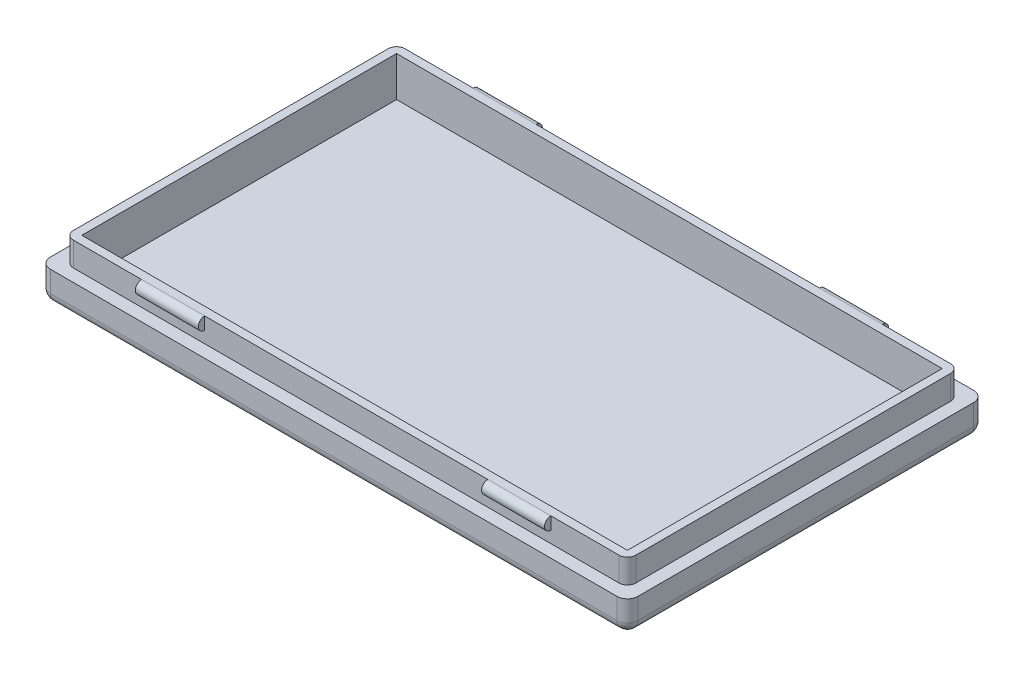
from build123d import *

# Parameters (mm, degrees)
SKETCH1_W           = 56
SKETCH1_H           = 34
BOSS_EXTRUDE1_DEPTH = 1.5
SKETCH1_3_W         = 56
SKETCH1_3_H         = 34
SKETCH1_3_W_2       = 52
SKETCH1_3_H_2       = 30
BOSS_EXTRUDE2_DEPTH = 3
SKETCH2_W           = 53.6
SKETCH2_H           = 31.6
SKETCH2_W_2         = 52
SKETCH2_H_2         = 30
BOSS_EXTRUDE3_DEPTH = 2.3
SKETCH3_W           = 1.2
SKETCH3_H           = 3.75
CUT_EXTRUDE1_DEPTH  = 1
BOSS_EXTRUDE4_START = 13.5
SKETCH4_R           = 0.6
BOSS_EXTRUDE4_DEPTH = 6
FILLET1_R           = 1
FILLET2_R           = 0.8


with BuildPart() as part:
    # Sketch1 → Boss-Extrude1 (new body)
    with BuildSketch(Plane(origin=(0, 0, 0), x_dir=(1, 0, 0), z_dir=(0, 1, 0))):
        Rectangle(SKETCH1_W, SKETCH1_H)
    extrude(amount=BOSS_EXTRUDE1_DEPTH)

    # Sketch1<3> → Boss-Extrude2 (add)
    with BuildSketch(Plane(origin=(0, 0, 0), x_dir=(1, 0, 0), z_dir=(0, 1, 0))):
        Rectangle(SKETCH1_3_W, SKETCH1_3_H)
        Rectangle(SKETCH1_3_W_2, SKETCH1_3_H_2, mode=Mode.SUBTRACT)
    extrude(amount=BOSS_EXTRUDE2_DEPTH)

    # Sketch2 → Boss-Extrude3 (add)
    with BuildSketch(Plane(origin=(0, 3, 0), x_dir=(1, 0, 0), z_dir=(0, 1, 0))):
        Rectangle(SKETCH2_W, SKETCH2_H)
        Rectangle(SKETCH2_W_2, SKETCH2_H_2, mode=Mode.SUBTRACT)
    extrude(amount=BOSS_EXTRUDE3_DEPTH)

    # Sketch3 → Cut-Extrude1 (cut)
    with BuildSketch(Plane(origin=(0, 3, 0), x_dir=(1, 0, 0), z_dir=(0, 1, 0))):
        with Locations((-27.4, -8.375)):
            Rectangle(SKETCH3_W, SKETCH3_H)
        with Locations((-27.4, 8.375)):
            Rectangle(SKETCH3_W, SKETCH3_H)
    extrude(amount=-CUT_EXTRUDE1_DEPTH, mode=Mode.SUBTRACT)

    # Sketch4 → Boss-Extrude4 (add)
    with BuildSketch(Plane(origin=(0, 0, 0), x_dir=(0, 0, -1), z_dir=(1, 0, 0)).offset(BOSS_EXTRUDE4_START)):
        with Locations((15.8, 4.7)):
            Circle(SKETCH4_R)
        with Locations((-15.8, 4.7)):
            Circle(SKETCH4_R)
    boss_extrude4 = extrude(amount=BOSS_EXTRUDE4_DEPTH)

    # Mirror1: Boss-Extrude4 across plane
    add(boss_extrude4.mirror(Plane(origin=(0, 0, 0), x_dir=(0, 0, 1), z_dir=(1, 0, 0))))

    # Fillet1
    fillet1_edges = [part.edges().sort_by_distance(p)[0] for p in [
        (0, 0, 17),
        (28, 0, 0),
        (0, 0, -17),
        (-28, 0, 0),
        (28, 1.5, 17),
        (-28, 1.5, 17),
        (-28, 1.5, -17),
        (28, 1.5, -17),
    ]]
    fillet(fillet1_edges, radius=FILLET1_R)

    # Fillet2
    fillet2_edges = [part.edges().sort_by_distance(p)[0] for p in [
        (26.8, 4.15, 15.8),
        (-26.8, 4.15, 15.8),
        (-26.8, 4.15, -15.8),
        (26.8, 4.15, -15.8),
    ]]
    fillet(fillet2_edges, radius=FILLET2_R)


solid = part.part
